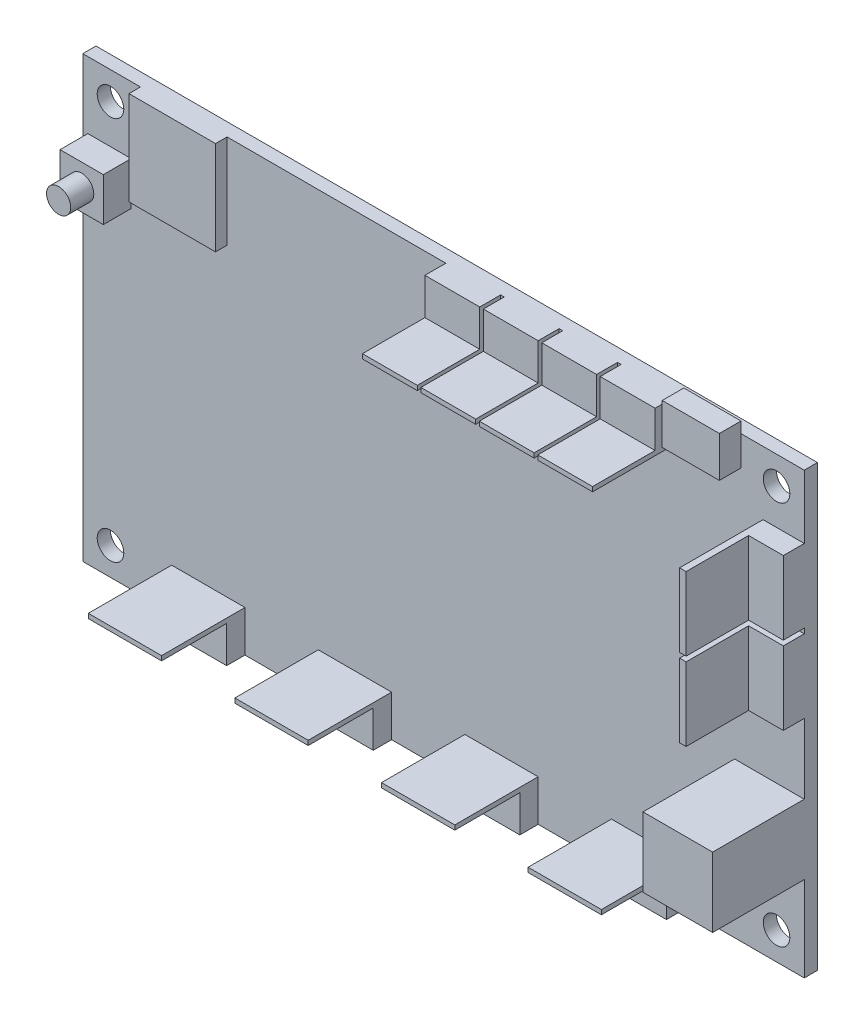
from build123d import *

# Parameters (mm, degrees)
SKETCH1_W             = 100
SKETCH1_H             = 60.96
BOSS_EXTRUDE1_DEPTH   = 1.8288
SKETCH2_W             = 10.16
SKETCH2_H             = 5.715
SKETCH2_W_2           = 5.715
SKETCH2_H_2           = 10.16
F_4_PIN_MOLEX_DEPTH   = 11.557
SKETCH3_W             = 9.017
SKETCH3_H             = 5.08
CUT_EXTRUDE1_DEPTH    = 105.19869463
SKETCH7_W             = 4.815
SKETCH7_H             = 8.657
CUT_EXTRUDE2_DEPTH    = 24.6
SKETCH4_W             = 9.652
SKETCH4_H             = 9.652
POWER_CONNECTOR_DEPTH = 12.7
SKETCH5_W             = 7.9248
SKETCH5_H             = 5.6388
MICROUSB_DEPTH        = 3
SKETCH6_W             = 12
SKETCH6_H             = 13
MICROSD_DEPTH         = 1.6
SKETCH8_W             = 6
SKETCH8_H             = 6
BOSS_EXTRUDE6_DEPTH   = 3.85
SKETCH9_R             = 1.675
BOSS_EXTRUDE7_DEPTH   = 3.2
SKETCH10_W            = 7.6
SKETCH10_H            = 5.715
BOSS_EXTRUDE8_DEPTH   = 11.557
SKETCH11_W            = 8.657
SKETCH11_H            = 5.08
CUT_EXTRUDE3_DEPTH    = 36.449
SKETCH13_R            = 1.8415
CUT_EXTRUDE4_DEPTH    = 36.449


with BuildPart() as part:
    # Sketch1 → Boss-Extrude1 (new body)
    with BuildSketch(Plane.XY):
        with Locations((50, 30.48)):
            Rectangle(SKETCH1_W, SKETCH1_H)
    extrude(amount=BOSS_EXTRUDE1_DEPTH)

    # Sketch2 → 4 pin molex (add)
    with BuildSketch(Plane.XY.offset(1.8288)):
        with Locations((17.399, 2.8575)):
            Rectangle(SKETCH2_W, SKETCH2_H)
        with Locations((37.719, 2.8575)):
            Rectangle(SKETCH2_W, SKETCH2_H)
        with Locations((58.039, 2.8575)):
            Rectangle(SKETCH2_W, SKETCH2_H)
        with Locations((78.359, 2.8575)):
            Rectangle(SKETCH2_W, SKETCH2_H)
        with Locations((97.1425, 47.08)):
            Rectangle(SKETCH2_W_2, SKETCH2_H_2)
        with Locations((97.1425, 36.24)):
            Rectangle(SKETCH2_W_2, SKETCH2_H_2)
    extrude(amount=F_4_PIN_MOLEX_DEPTH)

    # Sketch3 → Cut-Extrude1 (cut, through all)
    with BuildSketch(Plane(origin=(83.439, 0, 0), x_dir=(0, 0, -1), z_dir=(1, 0, 0))):
        with Locations((-8.8773, 2.54)):
            Rectangle(SKETCH3_W, SKETCH3_H)
    extrude(amount=-CUT_EXTRUDE1_DEPTH, mode=Mode.SUBTRACT)

    # Sketch7 → Cut-Extrude2 (cut)
    with BuildSketch(Plane(origin=(0, 31.16, 0), x_dir=(-1, 0, 0), z_dir=(0, -1, 0))):
        with Locations((-97.5925, -9.0573)):
            Rectangle(SKETCH7_W, SKETCH7_H)
    extrude(amount=-CUT_EXTRUDE2_DEPTH, mode=Mode.SUBTRACT)

    # Sketch4 → Power Connector (add)
    with BuildSketch(Plane.XY.offset(1.8288)):
        with Locations((95.174, 16.637)):
            Rectangle(SKETCH4_W, SKETCH4_H)
    extrude(amount=POWER_CONNECTOR_DEPTH)

    # Sketch5 → MicroUSB (add)
    with BuildSketch(Plane.XY.offset(1.8288)):
        with Locations((87.2746, 59.6646)):
            Rectangle(SKETCH5_W, SKETCH5_H)
    extrude(amount=MICROUSB_DEPTH)

    # Sketch6 → MicroSD (add)
    with BuildSketch(Plane.XY.offset(1.8288)):
        with Locations((14, 54.46)):
            Rectangle(SKETCH6_W, SKETCH6_H)
    extrude(amount=MICROSD_DEPTH)

    # Sketch8 → Boss-Extrude6 (add)
    with BuildSketch(Plane.XY.offset(1.8288)):
        with Locations((3.7, 48.71)):
            Rectangle(SKETCH8_W, SKETCH8_H)
    extrude(amount=BOSS_EXTRUDE6_DEPTH)

    # Sketch9 → Boss-Extrude7 (add)
    with BuildSketch(Plane.XY.offset(5.6788)):
        with Locations((3.7, 48.71)):
            Circle(SKETCH9_R)
    extrude(amount=BOSS_EXTRUDE7_DEPTH)

    # Sketch10 → Boss-Extrude8 (add)
    with BuildSketch(Plane.XY.offset(1.8288)):
        with Locations((78.42, 58.1025)):
            Rectangle(SKETCH10_W, SKETCH10_H)
        with Locations((70.32, 58.1025)):
            Rectangle(SKETCH10_W, SKETCH10_H)
        with Locations((62.22, 58.1025)):
            Rectangle(SKETCH10_W, SKETCH10_H)
        with Locations((54.12, 58.1025)):
            Rectangle(SKETCH10_W, SKETCH10_H)
    extrude(amount=BOSS_EXTRUDE8_DEPTH)

    # Sketch11 → Cut-Extrude3 (cut)
    with BuildSketch(Plane(origin=(82.22, 0, 0), x_dir=(0, 0, -1), z_dir=(1, 0, 0))):
        with Locations((-9.0573, 58.42)):
            Rectangle(SKETCH11_W, SKETCH11_H)
    extrude(amount=-CUT_EXTRUDE3_DEPTH, mode=Mode.SUBTRACT)

    # Sketch13 → Cut-Extrude4 (cut)
    with BuildSketch(Plane.XY.offset(1.8288)):
        with Locations((3.841500064, 57.1185)):
            Circle(SKETCH13_R)
        with Locations((3.841500064, 3.8415)):
            Circle(SKETCH13_R)
        with Locations((96.1585, 3.8415)):
            Circle(SKETCH13_R)
        with Locations((96.1585, 57.1185)):
            Circle(SKETCH13_R)
    extrude(amount=-CUT_EXTRUDE4_DEPTH, mode=Mode.SUBTRACT)


solid = part.part
